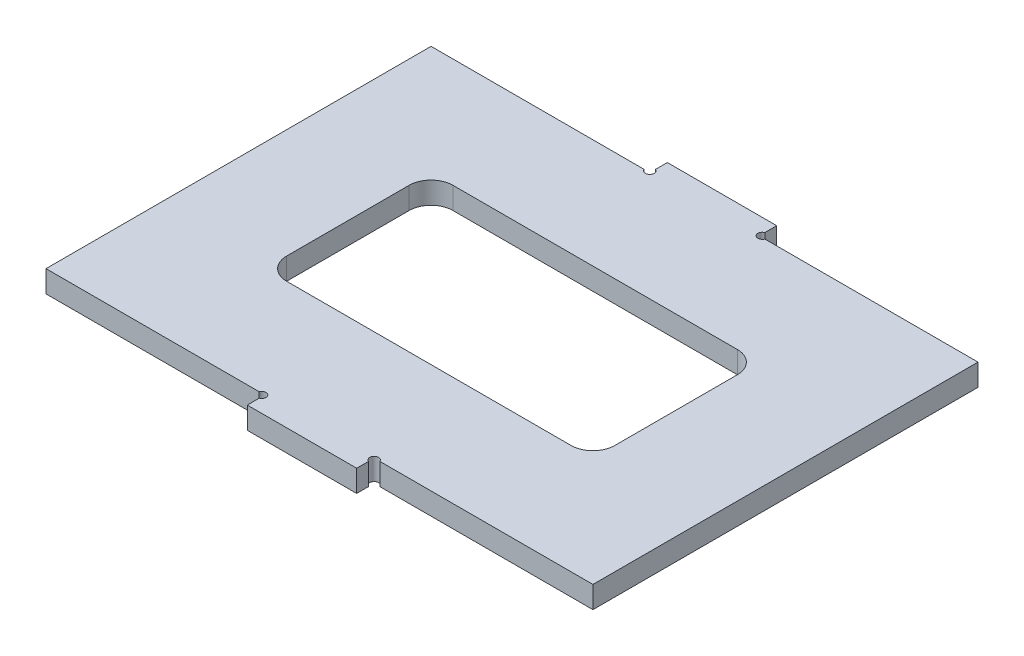
from build123d import *

# Parameters (mm, degrees)
SKETCH1_W           = 250
SKETCH1_H           = 176
BASE_FLANGE1_DEPTH  = 10
SKETCH6_W           = 50
SKETCH6_H           = 8
BOSS_EXTRUDE1_DEPTH = 10
SKETCH7_R           = 2
CUT_EXTRUDE1_DEPTH  = 158.927198417
SKETCH8_W           = 150
SKETCH8_H           = 76
CUT_EXTRUDE2_DEPTH  = 158.927198417
FILLET1_R           = 10


# Sheet-metal steps are written as plain solids
with BuildPart() as part:
    # Sketch1 → Base-Flange1 (new body)
    with BuildSketch(Plane(origin=(0, 0, 0), x_dir=(1, 0, 0), z_dir=(0, 1, 0))):
        Rectangle(SKETCH1_W, SKETCH1_H)
    extrude(amount=-BASE_FLANGE1_DEPTH)

    # Sketch6 → Boss-Extrude1 (add)
    with BuildSketch(Plane(origin=(0, 0, 0), x_dir=(1, 0, 0), z_dir=(0, 1, 0))):
        with Locations((0, 92)):
            Rectangle(SKETCH6_W, SKETCH6_H)
        with Locations((0, -92)):
            Rectangle(SKETCH6_W, SKETCH6_H)
    extrude(amount=-BOSS_EXTRUDE1_DEPTH)

    # Sketch7 → Cut-Extrude1 (cut, through all)
    with BuildSketch(Plane(origin=(0, 0, 0), x_dir=(1, 0, 0), z_dir=(0, 1, 0))):
        with Locations((25.707106781, 88.707106781)):
            Circle(SKETCH7_R)
        with Locations((-25.707106781, 88.707106781)):
            Circle(SKETCH7_R)
        with Locations((-25.707106781, -88.707106781)):
            Circle(SKETCH7_R)
        with Locations((25.707106781, -88.707106781)):
            Circle(SKETCH7_R)
    extrude(amount=-CUT_EXTRUDE1_DEPTH, mode=Mode.SUBTRACT)

    # Sketch8 → Cut-Extrude2 (cut, through all)
    with BuildSketch(Plane(origin=(0, 0, 0), x_dir=(1, 0, 0), z_dir=(0, 1, 0))):
        Rectangle(SKETCH8_W, SKETCH8_H)
    extrude(amount=-CUT_EXTRUDE2_DEPTH, mode=Mode.SUBTRACT)

    # Fillet1
    fillet1_edges = [part.edges().sort_by_distance(p)[0] for p in [
        (-75, -5, 38),
        (-75, -5, -38),
        (75, -5, -38),
        (75, -5, 38),
    ]]
    fillet(fillet1_edges, radius=FILLET1_R)


solid = part.part
